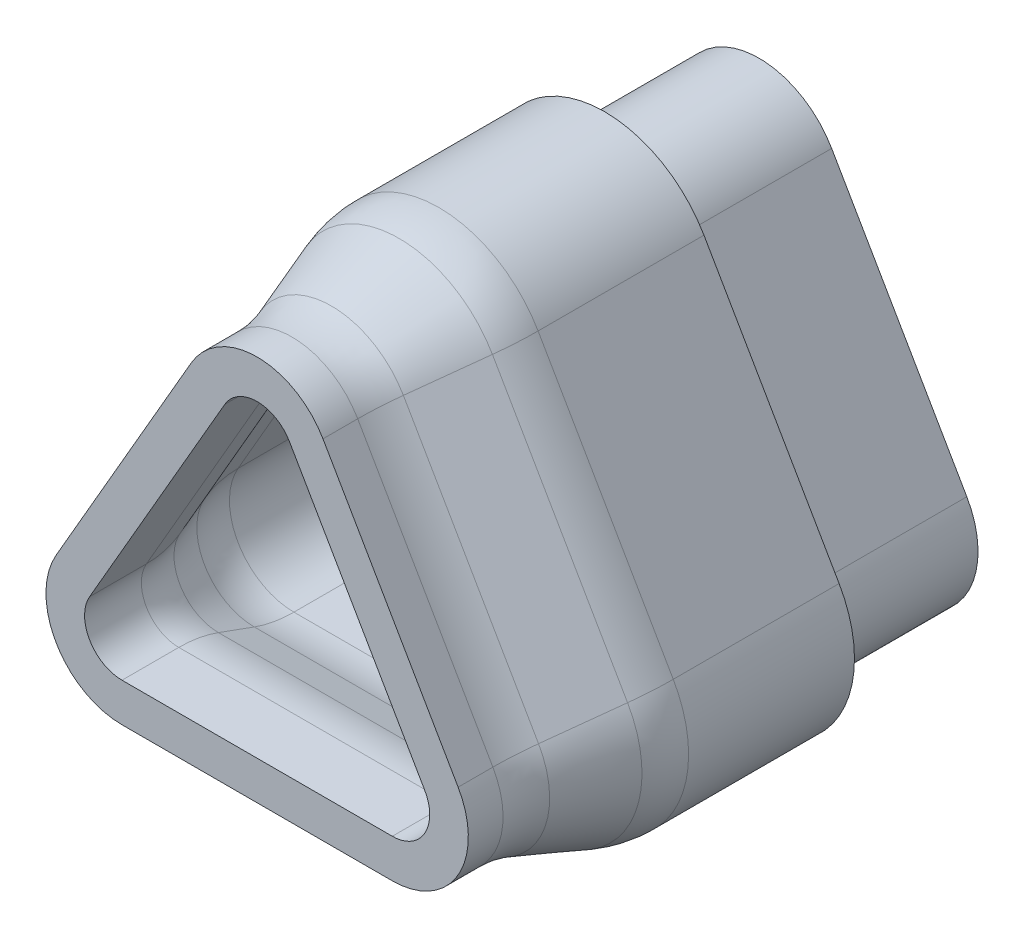
from build123d import *

# Parameters (mm, degrees)
EXTRUDE_1_DEPTH  = 4
EXTRUDE_2_DEPTH  = 4
EXTRUDE_3_DEPTH  = 5
CHAMFER_1_SIZE   = 1.3
CHAMFER_1_SIZE_2 = 3.571720645
CHAMFER_2_SIZE   = 3
CHAMFER_2_SIZE_2 = 1.091910703
FILLET_1_R       = 3
SKETCH_5_W       = 1
SKETCH_5_H       = 3
EXTRUDE_4_DEPTH  = 0.6
CHAMFER_3_SIZE2  = 0.715052156
CHAMFER_3_SIZE   = 0.6


# Some blends are built 0.0001 mm under size
with BuildPart() as part:
    # Эскиз2 → Бобышка-Вытянуть1 (new body)
    with BuildSketch(Plane.XY.offset(-4)):
        with BuildLine():
            Line((5.3783321, 4.05336663), (1.8783321, 10.115544457))
            ThreePointArc((1.8783321, 10.115544457), (0, 11.2), (-1.8783321, 10.115544457))
            Line((-1.8783321, 10.115544457), (-5.3783321, 4.05336663))
            ThreePointArc((-5.3783321, 4.05336663), (-5.3783321, 1.884455543), (-3.5, 0.8))
            Line((-3.5, 0.8), (3.5, 0.8))
            ThreePointArc((3.5, 0.8), (5.3783321, 1.884455543), (5.3783321, 4.05336663))
        make_face()
        with BuildLine():
            Line((-1.445319398, 9.865544457), (-4.945319398, 3.80336663))
            ThreePointArc((-4.945319398, 3.80336663), (-4.945319398, 2.134455543), (-3.5, 1.3))
            Line((-3.5, 1.3), (3.5, 1.3))
            ThreePointArc((3.5, 1.3), (4.945319398, 2.134455543), (4.945319398, 3.80336663))
            Line((4.945319398, 3.80336663), (1.445319398, 9.865544457))
            ThreePointArc((1.445319398, 9.865544457), (0, 10.7), (-1.445319398, 9.865544457))
        make_face(mode=Mode.SUBTRACT)
    extrude(amount=EXTRUDE_1_DEPTH)

    # Эскиз3 → Бобышка-Вытянуть2 (add)
    with BuildSketch(Plane.XY):
        with BuildLine():
            Line((-3.5, 0), (3.5, 0))
            ThreePointArc((3.5, 0), (6.071152423, 1.484455543), (6.071152423, 4.45336663))
            Line((6.071152423, 4.45336663), (2.571152423, 10.515544457))
            ThreePointArc((2.571152423, 10.515544457), (0, 12), (-2.571152423, 10.515544457))
            Line((-2.571152423, 10.515544457), (-6.071152423, 4.45336663))
            ThreePointArc((-6.071152423, 4.45336663), (-6.071152423, 1.484455543), (-3.5, 0))
        make_face()
        with BuildLine():
            Line((4.945319398, 3.80336663), (1.445319398, 9.865544457))
            ThreePointArc((1.445319398, 9.865544457), (0, 10.7), (-1.445319398, 9.865544457))
            Line((-1.445319398, 9.865544457), (-4.945319398, 3.80336663))
            ThreePointArc((-4.945319398, 3.80336663), (-4.945319398, 2.134455543), (-3.5, 1.3))
            Line((-3.5, 1.3), (3.5, 1.3))
            ThreePointArc((3.5, 1.3), (4.945319398, 2.134455543), (4.945319398, 3.80336663))
        make_face(mode=Mode.SUBTRACT)
    extrude(amount=EXTRUDE_2_DEPTH)

    # Эскиз4 → Бобышка-Вытянуть3 (add)
    with BuildSketch(Plane.XY.offset(4)):
        with BuildLine():
            Line((-1.705127019, 10.015544457), (-5.205127019, 3.95336663))
            ThreePointArc((-5.205127019, 3.95336663), (-5.205127019, 1.984455543), (-3.5, 1))
            Line((-3.5, 1), (3.5, 1))
            ThreePointArc((3.5, 1), (5.205127019, 1.984455543), (5.205127019, 3.95336663))
            Line((5.205127019, 3.95336663), (1.705127019, 10.015544457))
            ThreePointArc((1.705127019, 10.015544457), (0, 11), (-1.705127019, 10.015544457))
        make_face()
        with BuildLine():
            Line((-3.5, 2), (3.5, 2))
            ThreePointArc((3.5, 2), (4.339101615, 2.484455543), (4.339101615, 3.45336663))
            Line((4.339101615, 3.45336663), (0.839101615, 9.515544457))
            ThreePointArc((0.839101615, 9.515544457), (0, 10), (-0.839101615, 9.515544457))
            Line((-0.839101615, 9.515544457), (-4.339101615, 3.45336663))
            ThreePointArc((-4.339101615, 3.45336663), (-4.339101615, 2.484455543), (-3.5, 2))
        make_face(mode=Mode.SUBTRACT)
    extrude(amount=EXTRUDE_3_DEPTH)

    # Фаска1
    # the kernel refuses this chamfer: 3.571720645, 1.3 mm, written as the material it adds along each edge
    with BuildSketch(Plane(origin=(-3.5, 1, 4), x_dir=(0, -0.9950833631817486, -0.09904090225205049), z_dir=(1, 0, 0))) as chamfer_1_piece_1_section:
        Polygon((CHAMFER_1_SIZE * 0.995083363182, -CHAMFER_1_SIZE * 0.0990409022521), (-CHAMFER_1_SIZE_2 * 0.0990409022601, -CHAMFER_1_SIZE_2 * 0.995083363263), (0, 0), align=None)
    chamfer_1_piece_1 = extrude(amount=7, mode=Mode.PRIVATE)
    chamfer_1_piece_1 = split(chamfer_1_piece_1, bisect_by=Plane(origin=(-7e-09, 0, 5.183770474), z_dir=(0, 1, 0)), keep=Keep.TOP, mode=Mode.PRIVATE)
    add(chamfer_1_piece_1)
    with BuildSketch(Plane(origin=(3.5, 2.968911087, 4), x_dir=(0, -1, 0), z_dir=(-1, 0, 0))) as chamfer_1_piece_2_section:
        Polygon((1.968911087 + CHAMFER_1_SIZE, 0), (1.968911087, CHAMFER_1_SIZE_2), (1.968911087, 0), align=None)
    chamfer_1_piece_2 = revolve(axis=Axis((3.5, 2.968911087, 4), (0, 0, 1)), revolution_arc=120, mode=Mode.PRIVATE)
    chamfer_1_piece_2 = chamfer_1_piece_2 & Plane(origin=(3.5, 2.968911087, 5.239170832), x_dir=(0, -1, 0), z_dir=(0, 0, -1)) * Cylinder(2.968911087, 15, mode=Mode.PRIVATE)
    add(chamfer_1_piece_2)
    with BuildSketch(Plane(origin=(-3.5, 2.968911087, 4), x_dir=(-0.8660254037844399, 0.4999999999999977, 0), z_dir=(0.4999999999999977, 0.8660254037844399, 0))) as chamfer_1_piece_3_section:
        Polygon((1.968911087 + CHAMFER_1_SIZE, 0), (1.968911087, CHAMFER_1_SIZE_2), (1.968911087, 0), align=None)
    chamfer_1_piece_3 = revolve(axis=Axis((-3.5, 2.968911087, 4), (0, 0, 1)), revolution_arc=120, mode=Mode.PRIVATE)
    chamfer_1_piece_3 = chamfer_1_piece_3 & Plane(origin=(-3.5, 2.968911087, 5.239170832), x_dir=(-0.8660254037844396, 0.4999999999999984, 0), z_dir=(0, 0, -1)) * Cylinder(2.968911087, 15, mode=Mode.PRIVATE)
    add(chamfer_1_piece_3)
    with BuildSketch(Plane(origin=(5.205127019, 3.95336663, 4), x_dir=(0.8617674713986507, 0.497541681590875, -0.09904090225205049), z_dir=(-0.5000000000000007, 0.8660254037844384, 0))) as chamfer_1_piece_4_section:
        Polygon((CHAMFER_1_SIZE * 0.995083363182, -CHAMFER_1_SIZE * 0.0990409022521), (-CHAMFER_1_SIZE_2 * 0.0990409022601, -CHAMFER_1_SIZE_2 * 0.995083363263), (0, 0), align=None)
    chamfer_1_piece_4 = extrude(amount=7, mode=Mode.PRIVATE)
    chamfer_1_piece_4 = split(chamfer_1_piece_4, bisect_by=Plane(origin=(4.321152424, 7.484455541, 5.183770458), z_dir=(-0.8660254037844383, -0.5000000000000007, 0)), keep=Keep.TOP, mode=Mode.PRIVATE)
    add(chamfer_1_piece_4)
    with BuildSketch(Plane(origin=(-1.705127019, 10.015544457, 4), x_dir=(-0.8617674713986511, 0.49754168159087425, -0.09904090225205052), z_dir=(-0.49999999999999994, -0.8660254037844387, 0))) as chamfer_1_piece_5_section:
        Polygon((CHAMFER_1_SIZE * 0.995083363182, -CHAMFER_1_SIZE * 0.0990409022521), (-CHAMFER_1_SIZE_2 * 0.0990409022601, -CHAMFER_1_SIZE_2 * 0.995083363263), (0, 0), align=None)
    chamfer_1_piece_5 = extrude(amount=7, mode=Mode.PRIVATE)
    chamfer_1_piece_5 = split(chamfer_1_piece_5, bisect_by=Plane(origin=(-4.321152422, 7.484455545, 5.183770458), z_dir=(0.8660254037844385, -0.5000000000000003, 0)), keep=Keep.TOP, mode=Mode.PRIVATE)
    add(chamfer_1_piece_5)
    with BuildSketch(Plane(origin=(0, 9.031088913, 4), x_dir=(0.866025403784439, 0.49999999999999944, 0), z_dir=(0.49999999999999944, -0.866025403784439, 0))) as chamfer_1_piece_6_section:
        Polygon((1.968911087 + CHAMFER_1_SIZE, 0), (1.968911087, CHAMFER_1_SIZE_2), (1.968911087, 0), align=None)
    chamfer_1_piece_6 = revolve(axis=Axis((0, 9.031088913, 4), (0, 0, 1)), revolution_arc=120, mode=Mode.PRIVATE)
    chamfer_1_piece_6 = chamfer_1_piece_6 & Plane(origin=(0, 9.031088913, 5.239170832), x_dir=(0.866025403784439, 0.49999999999999933, 0), z_dir=(0, 0, -1)) * Cylinder(2.968911087, 15, mode=Mode.PRIVATE)
    add(chamfer_1_piece_6)

    # Фаска2
    # the kernel refuses this chamfer: 3, 1.091910703 mm, written as the material it takes off along each edge
    with BuildSketch(Plane(origin=(-3.5, 2, 4), x_dir=(0, 0.013184058198645864, 0.9999130865277315), z_dir=(1, 0, 0))) as chamfer_2_piece_1_section:
        Polygon((CHAMFER_2_SIZE * 0.999913086528, CHAMFER_2_SIZE * 0.0131840581986), (-CHAMFER_2_SIZE_2 * 0.0131840581962, CHAMFER_2_SIZE_2 * 0.999913086343), (0, 0), align=None)
    chamfer_2_piece_1 = extrude(amount=7, mode=Mode.PRIVATE)
    chamfer_2_piece_1 = split(chamfer_2_piece_1, bisect_by=Plane(origin=(-2.923308358, 1.3, 5.225786657), z_dir=(0, 1, 0)), keep=Keep.TOP, mode=Mode.PRIVATE)
    add(chamfer_2_piece_1, mode=Mode.SUBTRACT)
    with BuildSketch(Plane(origin=(3.5, 2.968911087, 4), x_dir=(0, -1, 0), z_dir=(-1, 0, 0))) as chamfer_2_piece_2_section:
        Polygon((0.968911087 + CHAMFER_2_SIZE_2, 0), (0.968911087, CHAMFER_2_SIZE), (0.968911087, 0), align=None)
    chamfer_2_piece_2 = revolve(axis=Axis((3.5, 2.968911087, 4), (0, 0, 1)), revolution_arc=120, mode=Mode.PRIVATE)
    chamfer_2_piece_2 = chamfer_2_piece_2 & Plane(origin=(3.5, 2.968911087, 5.086168239), x_dir=(0, -1, 0), z_dir=(0, 0, -1)) * Cylinder(1.668911087, 12, mode=Mode.PRIVATE)
    add(chamfer_2_piece_2, mode=Mode.SUBTRACT)
    with BuildSketch(Plane(origin=(-3.5, 2.968911087, 4), x_dir=(-0.8660254037844419, 0.4999999999999944, 0), z_dir=(0.4999999999999944, 0.8660254037844419, 0))) as chamfer_2_piece_3_section:
        Polygon((0.968911087 + CHAMFER_2_SIZE_2, 0), (0.968911087, CHAMFER_2_SIZE), (0.968911087, 0), align=None)
    chamfer_2_piece_3 = revolve(axis=Axis((-3.5, 2.968911087, 4), (0, 0, 1)), revolution_arc=120, mode=Mode.PRIVATE)
    chamfer_2_piece_3 = chamfer_2_piece_3 & Plane(origin=(-3.5, 2.968911087, 5.086168239), x_dir=(-0.8660254037844405, 0.49999999999999695, 0), z_dir=(0, 0, -1)) * Cylinder(1.668911087, 12, mode=Mode.PRIVATE)
    add(chamfer_2_piece_3, mode=Mode.SUBTRACT)
    with BuildSketch(Plane(origin=(4.339101615, 3.45336663, 4), x_dir=(0.8617674713986508, 0.4975416815908748, -0.09904090225204927), z_dir=(-0.5000000000000004, 0.8660254037844384, 0))) as chamfer_2_piece_4_section:
        Polygon((CHAMFER_2_SIZE_2 * 0.995083362998, -CHAMFER_2_SIZE_2 * 0.0990409022338), (-CHAMFER_2_SIZE * 0.099040902252, -CHAMFER_2_SIZE * 0.995083363182), (0, 0), align=None)
    chamfer_2_piece_4 = extrude(amount=7, mode=Mode.PRIVATE)
    chamfer_2_piece_4 = split(chamfer_2_piece_4, bisect_by=Plane(origin=(3.195319408, 6.834455526, 5.1059003), z_dir=(-0.8660254037844385, -0.5000000000000004, 0)), keep=Keep.TOP, mode=Mode.PRIVATE)
    add(chamfer_2_piece_4, mode=Mode.SUBTRACT)
    with BuildSketch(Plane(origin=(-0.839101615, 9.515544457, 4), x_dir=(-0.8617674713986513, 0.4975416815908743, -0.09904090225204927), z_dir=(-0.49999999999999994, -0.8660254037844387, 0))) as chamfer_2_piece_5_section:
        Polygon((CHAMFER_2_SIZE_2 * 0.995083362998, -CHAMFER_2_SIZE_2 * 0.0990409022338), (-CHAMFER_2_SIZE * 0.099040902252, -CHAMFER_2_SIZE * 0.995083363182), (0, 0), align=None)
    chamfer_2_piece_5 = extrude(amount=7, mode=Mode.PRIVATE)
    chamfer_2_piece_5 = split(chamfer_2_piece_5, bisect_by=Plane(origin=(-3.195319387, 6.834455562, 5.1059003), z_dir=(0.8660254037844387, -0.4999999999999999, 0)), keep=Keep.TOP, mode=Mode.PRIVATE)
    add(chamfer_2_piece_5, mode=Mode.SUBTRACT)
    with BuildSketch(Plane(origin=(0, 9.031088913, 4), x_dir=(0.8660254037844403, 0.4999999999999973, 0), z_dir=(0.4999999999999973, -0.8660254037844403, 0))) as chamfer_2_piece_6_section:
        Polygon((0.968911087 + CHAMFER_2_SIZE_2, 0), (0.968911087, CHAMFER_2_SIZE), (0.968911087, 0), align=None)
    chamfer_2_piece_6 = revolve(axis=Axis((0, 9.031088913, 4), (0, 0, 1)), revolution_arc=120, mode=Mode.PRIVATE)
    chamfer_2_piece_6 = chamfer_2_piece_6 & Plane(origin=(0, 9.031088913, 5.086168239), x_dir=(0.8660254037844393, 0.49999999999999906, 0), z_dir=(0, 0, -1)) * Cylinder(1.668911087, 12, mode=Mode.PRIVATE)
    add(chamfer_2_piece_6, mode=Mode.SUBTRACT)

    # Скругление1
    fillet_1_edges = [part.edges().sort_by_distance(p)[0] for p in [
        (0, 1, 7.571720645),
        (5.205127019, 1.984455543, 7.571720645),
        (-5.205127019, 1.984455543, 7.571720645),
        (3.455127019, 6.984455543, 7.571720645),
        (-3.455127019, 6.984455543, 7.571720645),
        (0, 11, 7.571720645),
        (0, 0, 4.824243226),
        (6.071152423, 1.484455543, 4.824243226),
        (-6.071152423, 1.484455543, 4.824243226),
        (4.321152423, 7.484455543, 4.824243226),
        (-4.321152423, 7.484455543, 4.824243226),
        (0, 12, 4.824243226),
        (0, 2, 7),
        (4.339101615, 2.484455543, 7),
        (-4.339101615, 2.484455543, 7),
        (2.589101615, 6.484455543, 7),
        (-2.589101615, 6.484455543, 7),
        (0, 10, 7),
        (0, 1.3, 5.076765806),
        (4.945319398, 2.134455543, 5.076765807),
        (-4.945319398, 2.134455543, 5.076765807),
        (3.195319398, 6.834455543, 5.076765806),
        (-3.195319398, 6.834455543, 5.076765806),
        (0, 10.7, 5.076765807),
    ]]
    fillet(fillet_1_edges, radius=FILLET_1_R)

    # Эскиз5 → Бобышка-Вытянуть4 (add)
    with BuildSketch(Plane(origin=(-5.788908311, 3.342227772, 0), x_dir=(0, 0, 1), z_dir=(-0.8660254037844387, 0.49999999999999983, 0))):
        with Locations((-1.5, 4.321152423)):
            Rectangle(SKETCH_5_W, SKETCH_5_H)
    extrude(amount=EXTRUDE_4_DEPTH)

    # Фаска3
    chamfer_3_edges = [part.edges().sort_by_distance(p)[0] for p in [
        (-4.147947342, 7.384455543, -2),
    ]]
    chamfer_3_side = [part.faces().sort_by_distance(p)[0] for p in [
        (-4.137555037, 7.378455543, -2),
    ]]
    chamfer(chamfer_3_edges, length=CHAMFER_3_SIZE - 0.0001, length2=CHAMFER_3_SIZE2 - 0.0001, reference=chamfer_3_side[0])  # a hair under: the kernel refuses the full size


solid = part.part
